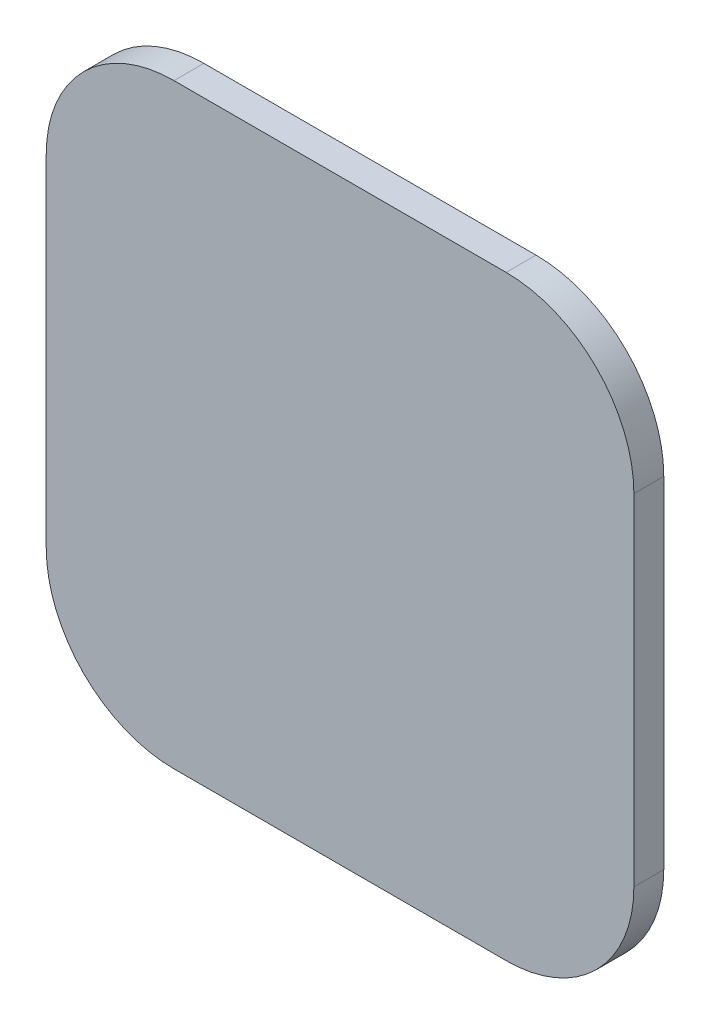
from build123d import *

# Parameters (mm, degrees)
SKETCH2_W          = 23
SKETCH2_H          = 23.33
BASE_FLANGE1_DEPTH = 1.17
FILLET1_R          = 5


# Sheet-metal steps are written as plain solids
with BuildPart() as part:
    # Sketch2 → Base-Flange1 (new body)
    with BuildSketch(Plane.XY):
        with Locations((11.5, 11.665)):
            Rectangle(SKETCH2_W, SKETCH2_H)
    extrude(amount=-BASE_FLANGE1_DEPTH)

    # Fillet1
    fillet1_edges = [part.edges().sort_by_distance(p)[0] for p in [
        (0, 23.33, -0.585),
        (23, 23.33, -0.585),
        (23, 0, -0.585),
        (0, 0, -0.585),
    ]]
    fillet(fillet1_edges, radius=FILLET1_R)


solid = part.part
